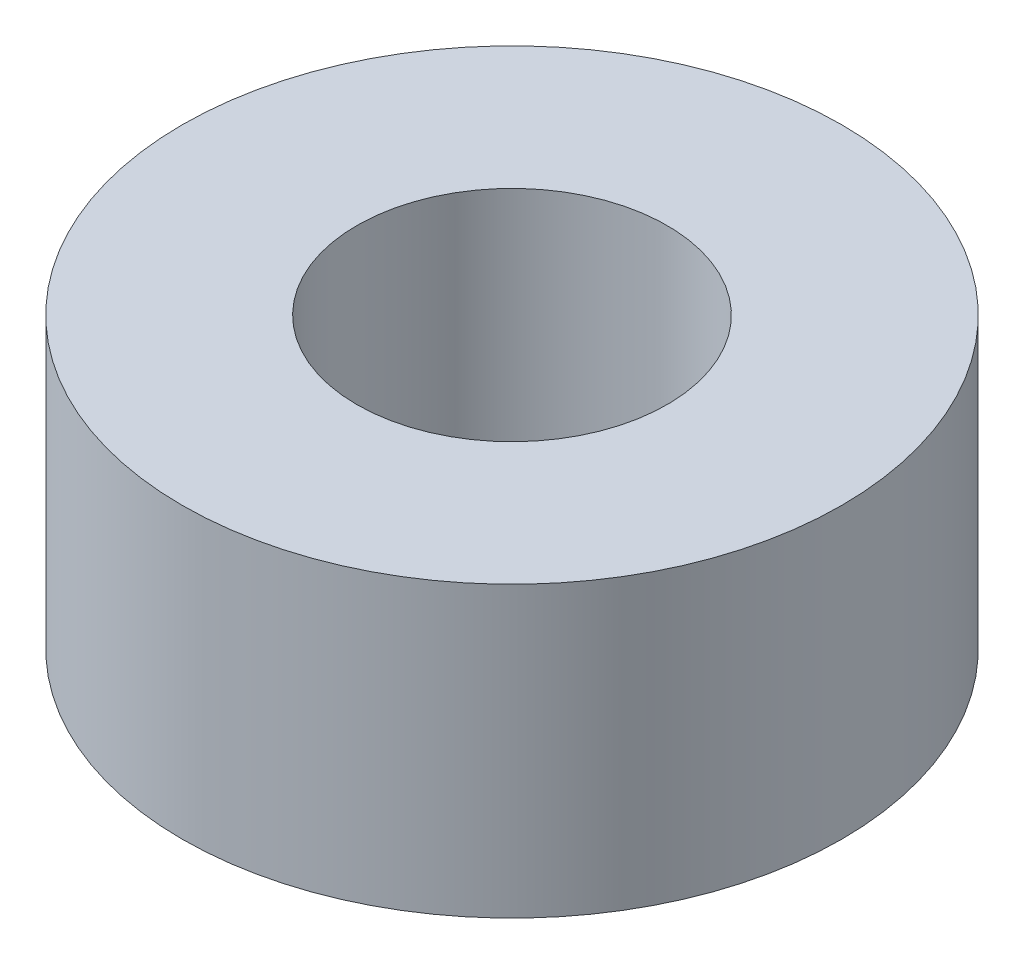
from build123d import *

# Parameters (mm, degrees)
SKETCH1_R           = 4.675
SKETCH1_R_2         = 2.2
BOSS_EXTRUDE1_DEPTH = 4.1


with BuildPart() as part:
    # Sketch1 → Boss-Extrude1 (new body)
    with BuildSketch(Plane(origin=(0, 0, 0), x_dir=(1, 0, 0), z_dir=(0, 1, 0))):
        Circle(SKETCH1_R)
        Circle(SKETCH1_R_2, mode=Mode.SUBTRACT)
    extrude(amount=BOSS_EXTRUDE1_DEPTH)


solid = part.part
